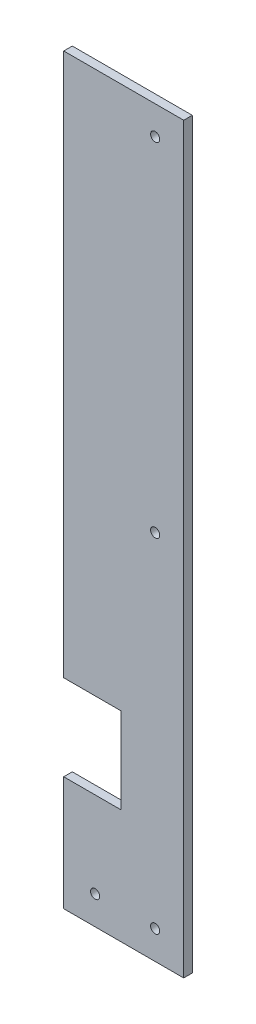
from build123d import *

# Parameters (mm, degrees)
SKETCH1_W                    = 42
SKETCH1_H                    = 260
BOSS_EXTRUDE1_DEPTH          = 3
M3_CLEARANCE_HOLE1_OUTLINE_R = 1.6
M3_CLEARANCE_HOLE1_DEPTH     = 3
SKETCH4_W                    = 20
SKETCH4_H                    = 30
CUT_EXTRUDE1_DEPTH           = 10


# Read off the part's stored shape, not the designer's step: M3 Clearance Hole1
with BuildPart() as part:
    # Sketch1 → Boss-Extrude1 (new body)
    with BuildSketch(Plane.XY):
        with Locations((21, 130)):
            Rectangle(SKETCH1_W, SKETCH1_H)
    extrude(amount=BOSS_EXTRUDE1_DEPTH)

    # M3 Clearance Hole1 outline → M3 Clearance Hole1 (cut)
    with BuildSketch(Plane.XY):
        with Locations((32, 130)):
            Circle(M3_CLEARANCE_HOLE1_OUTLINE_R)
        with Locations((32, 10)):
            Circle(M3_CLEARANCE_HOLE1_OUTLINE_R)
        with Locations((32, 250)):
            Circle(M3_CLEARANCE_HOLE1_OUTLINE_R)
        with Locations((11, 10)):
            Circle(M3_CLEARANCE_HOLE1_OUTLINE_R)
    extrude(amount=M3_CLEARANCE_HOLE1_DEPTH, mode=Mode.SUBTRACT)

    # Sketch4 → Cut-Extrude1 (cut)
    with BuildSketch(Plane.XY.offset(3)):
        with Locations((10, 55)):
            Rectangle(SKETCH4_W, SKETCH4_H)
    extrude(amount=-CUT_EXTRUDE1_DEPTH, mode=Mode.SUBTRACT)


solid = part.part
